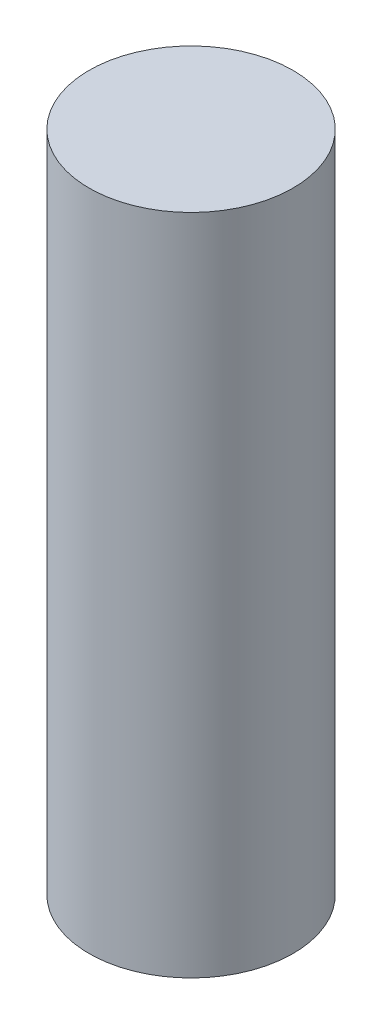
from build123d import *

# Parameters (mm, degrees)
SKETCH1_R           = 4
BOSS_EXTRUDE1_DEPTH = 26


with BuildPart() as part:
    # Sketch1 → Boss-Extrude1 (new body)
    with BuildSketch(Plane(origin=(0, 0, 0), x_dir=(1, 0, 0), z_dir=(0, 1, 0))):
        Circle(SKETCH1_R)
    extrude(amount=BOSS_EXTRUDE1_DEPTH)


solid = part.part
